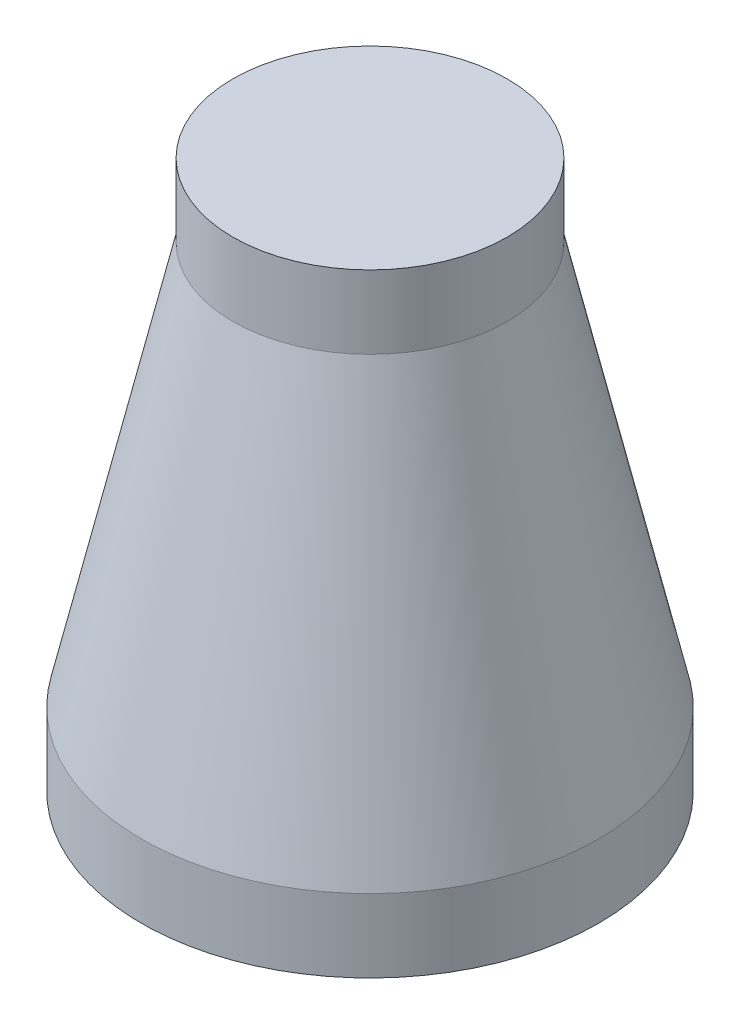
from build123d import *


with BuildPart() as part:
    # 草图1 → 旋转1 (revolve)
    with BuildSketch(Plane.XY):
        Polygon((0, -8), (0, -52), (0, -60), (25, -60), (25, -52), (15, -8), (15, 0), (0, 0), align=None)
    revolve(axis=Axis((0, -8, 0), (0, -1, 0)))


solid = part.part
